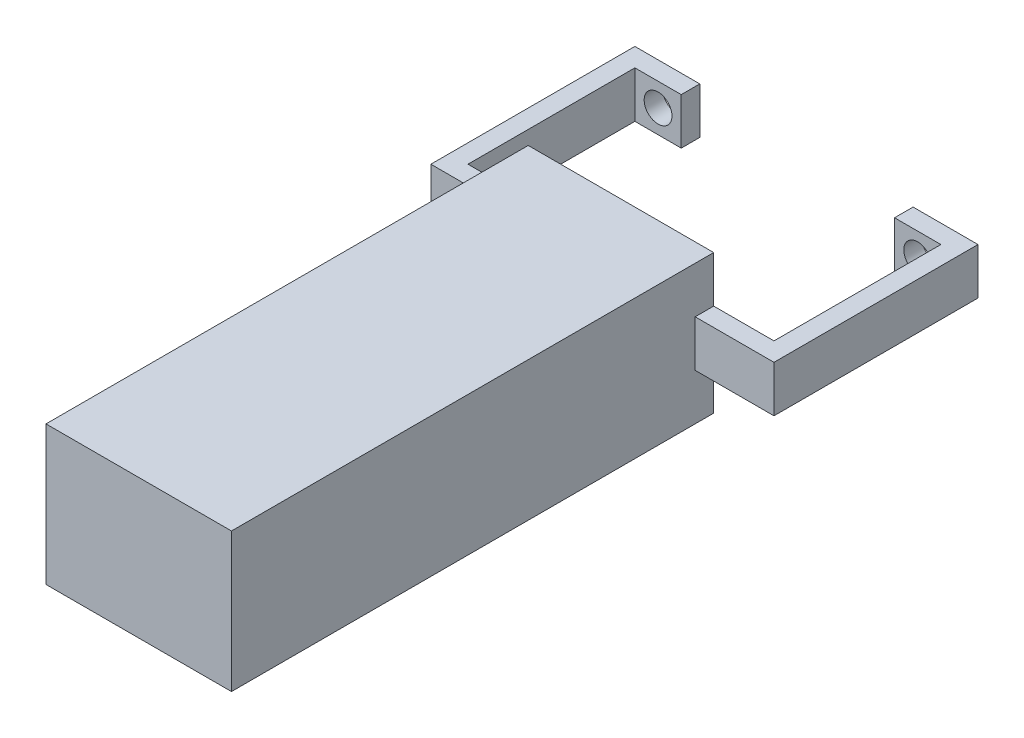
from build123d import *

# Parameters (mm, degrees)
SKETCH_1_R           = 1.5
EXTRUDE_1_DEPTH      = 2
EXTRUDE_1_2_DEPTH    = 2
SKETCH_3_W           = 2
SKETCH_3_H           = 5
EXTRUDE_2_DEPTH      = 18
SKETCH_4_W           = 2
SKETCH_4_H           = 5
EXTRUDE_3_DEPTH      = 37
EXTRUDE_4_DEPTH      = 50
EXTRUDE_4_DEPTH_BACK = 2


with BuildPart() as part:
    # Эскиз1 → Бобышка-Вытянуть1 (new body)
    with BuildSketch(Plane.XY):
        Polygon((11.5, 0), (11.5, 2.5), (16.5, 2.5), (18.5, 2.5), (18.5, -2.5), (16.5, -2.5), (11.5, -2.5), align=None)
        with Locations((14, 0)):
            Circle(SKETCH_1_R, mode=Mode.SUBTRACT)
    extrude(amount=EXTRUDE_1_DEPTH)



with BuildPart() as body_2:
    # Эскиз1 → Extrude 1 2 (new body)
    with BuildSketch(Plane.XY):
        Polygon((-16.5, 2.5), (-18.5, 2.5), (-18.5, -2.5), (-16.5, -2.5), (-11.5, -2.5), (-11.5, 0), (-11.5, 2.5), align=None)
        with Locations((-14, 0)):
            Circle(SKETCH_1_R, mode=Mode.SUBTRACT)
    extrude(amount=EXTRUDE_1_2_DEPTH)


with BuildPart() as part_1:
    add(part.part)

    add(body_2.part)  # Бобышка-Вытянуть2 merges body 2
    # Эскиз3 → Бобышка-Вытянуть2 (add)
    with BuildSketch(Plane.XY.offset(2)):
        with Locations((-17.5, 0)):
            Rectangle(SKETCH_3_W, SKETCH_3_H)
        with Locations((17.5, 0)):
            Rectangle(SKETCH_3_W, SKETCH_3_H)
    extrude(amount=EXTRUDE_2_DEPTH)

    # Эскиз4 → Бобышка-Вытянуть3 (add)
    with BuildSketch(Plane(origin=(18.5, 0, 0), x_dir=(0, 0, -1), z_dir=(1, 0, 0))):
        with Locations((-21, 0)):
            Rectangle(SKETCH_4_W, SKETCH_4_H)
    extrude(amount=-EXTRUDE_3_DEPTH)

    # Эскиз5 → Бобышка-Вытянуть4 (add, two sides: drawn at the far end of the back side and taken through both)
    with BuildSketch(Plane.XY.offset(22).offset(-EXTRUDE_4_DEPTH_BACK)):
        Polygon((-10, 2.5), (-10, 7.5), (10, 7.5), (10, -7.5), (-10, -7.5), align=None)
    extrude(amount=EXTRUDE_4_DEPTH + EXTRUDE_4_DEPTH_BACK)


solid = part_1.part
